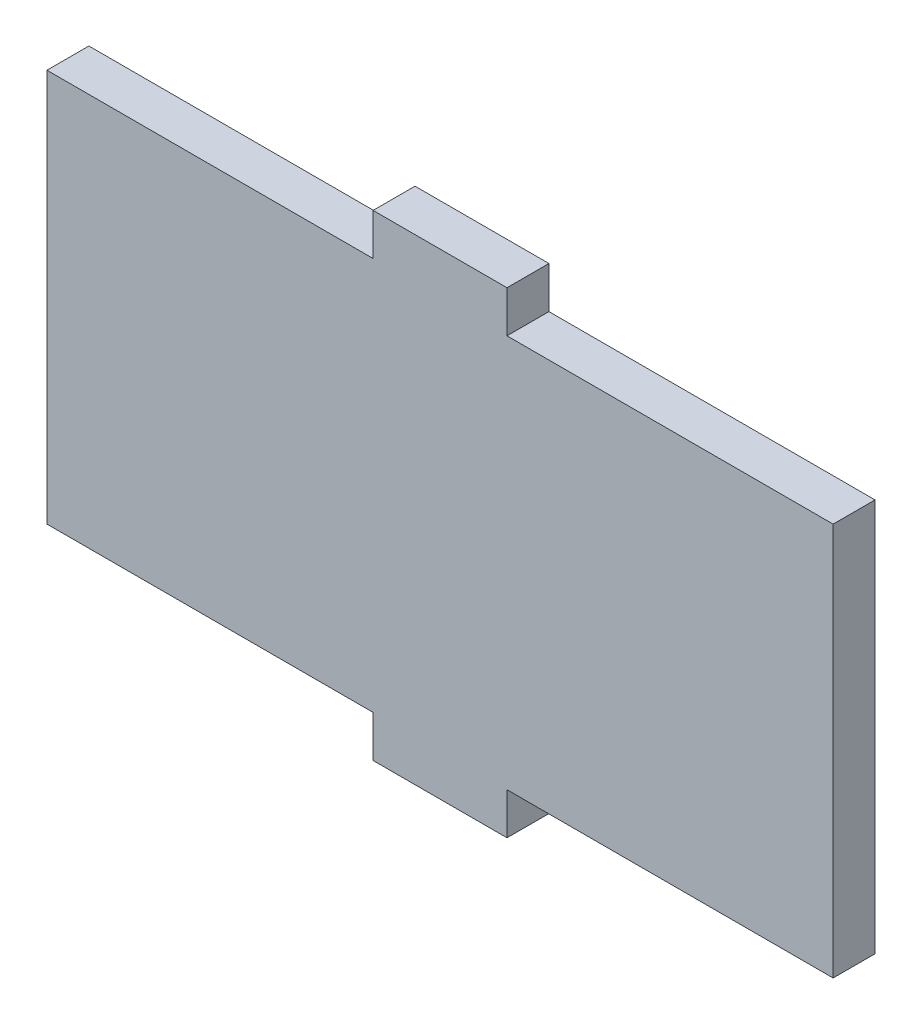
from build123d import *

# Parameters (mm, degrees)
SKETCH4_W              = 60
SKETCH4_H              = 30
SIDE_DEPTH             = 3.2
SKETCH8_W              = 10.22
SKETCH8_H              = 3.2
FRICTION_EXTRUDE_DEPTH = 3.18


with BuildPart() as part:
    # Sketch4 → Side (new body)
    with BuildSketch(Plane.XY):
        Rectangle(SKETCH4_W, SKETCH4_H)
    extrude(amount=SIDE_DEPTH)

    # Sketch8 → Friction Extrude (add)
    with BuildSketch(Plane(origin=(0, 15, 0), x_dir=(1, 0, 0), z_dir=(0, 1, 0))):
        with Locations((0, -1.6)):
            Rectangle(SKETCH8_W, SKETCH8_H)
    friction_extrude = extrude(amount=FRICTION_EXTRUDE_DEPTH)

    # Mirror 2: Friction Extrude across plane
    add(friction_extrude.mirror(Plane.ZX))


solid = part.part
